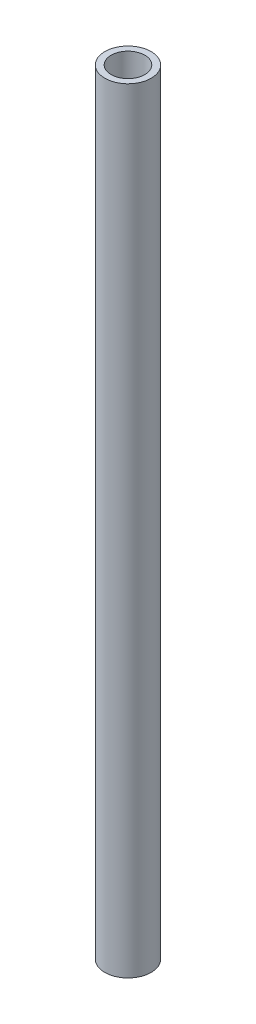
from build123d import *

# Parameters (mm, degrees)
SKETCH1_R           = 16.7005
SKETCH1_R_2         = 12.1539
BOSS_EXTRUDE1_DEPTH = 279.4


with BuildPart() as part:
    # Sketch1 → Boss-Extrude1 (new, symmetric)
    with BuildSketch(Plane(origin=(0, 0, 0), x_dir=(1, 0, 0), z_dir=(0, 1, 0))):
        Circle(SKETCH1_R)
        Circle(SKETCH1_R_2, mode=Mode.SUBTRACT)
    extrude(amount=BOSS_EXTRUDE1_DEPTH, both=True)


solid = part.part
